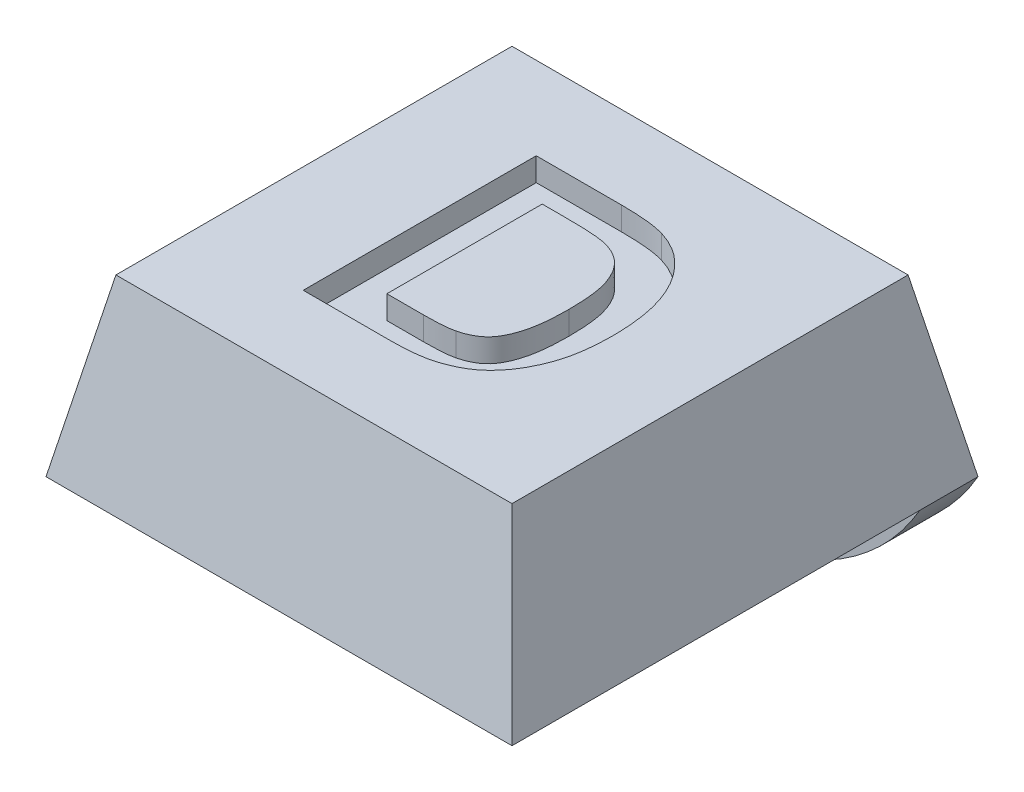
from build123d import *

# Parameters (mm, degrees)
SKETCH1_W               = 8
SKETCH1_H               = 8
BOSS_EXTRUDE1_DEPTH     = 3
CUT_EXTRUDE1_DEPTH      = 12.704699911
CUT_EXTRUDE1_DEPTH_BACK = 12.704699911
CUT_EXTRUDE2_DEPTH      = 11
SKETCH4_R               = 1.8
CUT_EXTRUDE3_DEPTH      = 0.8
SKETCH5_W               = 8
SKETCH5_H               = 1
BOSS_EXTRUDE2_DEPTH     = 2
FILLET1_R               = 4
CUT_EXTRUDE4_DEPTH      = 0.4


with BuildPart() as part:
    # Sketch1 → Boss-Extrude1 (new body)
    with BuildSketch(Plane(origin=(0, 0, 0), x_dir=(1, 0, 0), z_dir=(0, 1, 0))):
        with Locations((4, 4)):
            Rectangle(SKETCH1_W, SKETCH1_H)
    extrude(amount=BOSS_EXTRUDE1_DEPTH)

    # Sketch2 → Cut-Extrude1 (cut, two sides: drawn at the far end of the back side and taken through both)
    with BuildSketch(Plane.XY.offset(-CUT_EXTRUDE1_DEPTH_BACK)):
        Polygon((0, 0), (0.6, 3), (0, 3), align=None)
        Polygon((8, 0), (7.4, 3), (8, 3), align=None)
    extrude(amount=CUT_EXTRUDE1_DEPTH + CUT_EXTRUDE1_DEPTH_BACK, mode=Mode.SUBTRACT)

    # Sketch3 → Cut-Extrude2 (cut)
    with BuildSketch(Plane(origin=(0, 0, 0), x_dir=(0, 0, -1), z_dir=(1, 0, 0))):
        Polygon((0, 0), (0.6, 3), (0, 3), align=None)
        Polygon((8, 3), (7.4, 3), (8, 0), align=None)
    extrude(amount=CUT_EXTRUDE2_DEPTH, mode=Mode.SUBTRACT)

    # Sketch4 → Cut-Extrude3 (cut)
    with BuildSketch(Plane.XZ):
        with Locations(Location((4, -3.75, 0), (0, 0, 270))):
            Circle(SKETCH4_R)
    extrude(amount=-CUT_EXTRUDE3_DEPTH, mode=Mode.SUBTRACT)

    # Sketch5 → Boss-Extrude2 (add)
    with BuildSketch(Plane.XZ):
        with Locations((4, -7.5)):
            Rectangle(SKETCH5_W, SKETCH5_H)
    extrude(amount=BOSS_EXTRUDE2_DEPTH)

    # Fillet1
    # the kernel refuses this fillet: 4 mm, written as the material it takes off along each edge
    with BuildSketch(Plane(origin=(8, -2, -16.660254038), x_dir=(0, 1, 0), z_dir=(0, 0, 1)), Plane(origin=(0, -2, 1.660254038), x_dir=(0, 1, 0), z_dir=(0, 0, -1))) as fillet1_piece_1:
        with BuildLine():
            CenterArc((4, 3.464101615), FILLET1_R, 180, 60)
            Line((0, 3.464101615), (-0.08, 3.464101615))
            Line((-0.08, 3.464101615), (-0.08, 0))
            Line((-0.08, 0), (0, -0.08))
            ThreePointArc((0, -0.08), (1, -0.08), (1.96, -0.069282032))
            Line((1.96, -0.069282032), (2, 0))
        make_face()
    extrude(amount=18.320508076, mode=Mode.SUBTRACT)

    # Sketch6 → Cut-Extrude4 (cut)
    with BuildSketch(Plane(origin=(0, 3, 0), x_dir=(1, 0, 0), z_dir=(0, 1, 0))):
        with BuildLine():
            Line((2.436272881, 5.979723732), (3.903420317, 5.979723732))
            add(Edge.make_bspline(
                [(3.903420317, 5.979723732), (3.943490496, 5.979744505), (4.021516441, 5.979784954), (4.134752515, 5.975087302), (4.240642802, 5.970362082), (4.338883372, 5.960903224), (4.429815049, 5.950988663), (4.51360101, 5.938436084), (4.589711972, 5.922348579), (4.637707501, 5.909661658), (4.660631856, 5.903601937)],
                knots=[0, 0, 0, 0, 1.259756885, 2.453039283, 3.563158368, 4.591894114, 5.55549294, 6.43918076, 7.254497783, 8, 8, 8, 8], degree=3))
            add(Edge.make_bspline(
                [(4.660631856, 5.903601937), (4.689300162, 5.894258489), (4.74612039, 5.87573989), (4.829420592, 5.843292221), (4.908343197, 5.803050568), (4.985816138, 5.760749105), (5.058380803, 5.710732544), (5.129877456, 5.658697008), (5.195666079, 5.598419283), (5.281939397, 5.514177193), (5.380383811, 5.396825298), (5.483519335, 5.241163905), (5.570813292, 5.070304112), (5.630456537, 4.917219685), (5.670729972, 4.787084992), (5.697056277, 4.682749965), (5.719418871, 4.572846322), (5.737778631, 4.457346355), (5.752043635, 4.336250048), (5.762664083, 4.209589679), (5.767837312, 4.07725583), (5.769008616, 3.987205692), (5.769606215, 3.941262194)],
                knots=[0, 0, 0, 0, 0.745524535, 1.477620414, 2.207090574, 2.934465325, 3.657932502, 4.384347339, 5.118673636, 5.861150177, 7.365375624, 8.894729774, 10.468936425, 12.099947606, 12.950091786, 13.83580991, 14.759228729, 15.722225242, 16.726454549, 17.773376212, 18.863978586, 20, 20, 20, 20], degree=3))
            add(Edge.make_bspline(
                [(5.769606215, 3.941262194), (5.768515323, 3.861857727), (5.766405561, 3.708291084), (5.741963835, 3.486695058), (5.70674022, 3.280872561), (5.667035899, 3.152471539), (5.647811343, 3.090300655)],
                knots=[0, 0, 0, 0, 1.103207939, 2.133582005, 3.096293362, 4, 4, 4, 4], degree=3))
            add(Edge.make_bspline(
                [(5.647811343, 3.090300655), (5.635116766, 3.054625647), (5.610144552, 2.98444734), (5.566445051, 2.883214788), (5.519227431, 2.786877042), (5.468100041, 2.695510004), (5.412804571, 2.609524646), (5.353134197, 2.529178156), (5.290013855, 2.453412746), (5.244286819, 2.406778778), (5.221529292, 2.383569886)],
                knots=[0, 0, 0, 0, 1.090884612, 2.145940218, 3.175104604, 4.181306866, 5.161203701, 6.118658341, 7.063689906, 8, 8, 8, 8], degree=3))
            add(Edge.make_bspline(
                [(5.221529292, 2.383569886), (5.184702113, 2.350450915), (5.108759222, 2.282154876), (4.974934842, 2.197635799), (4.823675662, 2.122952418), (4.714264019, 2.084588805), (4.657426727, 2.06465963)],
                knots=[0, 0, 0, 0, 0.908140292, 1.872714733, 2.8949153, 4, 4, 4, 4], degree=3))
            add(Edge.make_bspline(
                [(4.657426727, 2.06465963), (4.634546833, 2.057632533), (4.587060796, 2.043048157), (4.511767003, 2.027471741), (4.431388989, 2.011061834), (4.344999886, 2.001176252), (4.253496453, 1.990751469), (4.156149493, 1.984898536), (4.053296456, 1.980743294), (3.98275208, 1.980068625), (3.946689548, 1.979723732)],
                knots=[0, 0, 0, 0, 0.799129865, 1.658552685, 2.566799617, 3.538529252, 4.561352959, 5.643373779, 6.795284424, 8, 8, 8, 8], degree=3))
            Line((3.946689548, 1.979723732), (2.436272881, 1.979723732))
            Line((2.436272881, 1.979723732), (2.436272881, 5.979723732))
        make_face()
        with BuildLine():
            Line((3.205503651, 5.313057065), (3.205503651, 2.646390399))
            Line((3.205503651, 2.646390399), (3.838516471, 2.646390399))
            add(Edge.make_bspline(
                [(3.838516471, 2.646390399), (3.86709534, 2.646617049), (3.922120581, 2.647053436), (4.001743514, 2.648335709), (4.07491632, 2.651807064), (4.142022322, 2.655402822), (4.202886818, 2.661343643), (4.257774639, 2.667186667), (4.306380252, 2.675360935), (4.336400272, 2.681813595), (4.350535702, 2.684851937)],
                knots=[0, 0, 0, 0, 1.333384787, 2.567275092, 3.714769766, 4.750907381, 5.701951617, 6.567520054, 7.325492842, 8, 8, 8, 8], degree=3))
            add(Edge.make_bspline(
                [(4.350535702, 2.684851937), (4.38364248, 2.693686468), (4.44812575, 2.710893803), (4.538666782, 2.749253907), (4.62059475, 2.795531175), (4.695281698, 2.8511776), (4.762590099, 2.92150181), (4.820046047, 3.011440962), (4.873220012, 3.118706088), (4.909633556, 3.221385639), (4.935771128, 3.313096613), (4.95346412, 3.390071897), (4.967446413, 3.47335137), (4.979473009, 3.562606359), (4.989190784, 3.657722085), (4.995237644, 3.759042029), (4.999364663, 3.866442163), (5.000032135, 3.940189623), (5.000375445, 3.978121168)],
                knots=[0, 0, 0, 0, 1.038686998, 2.023088296, 2.974059649, 3.888265163, 4.839857954, 5.909819677, 7.113156087, 8.466843969, 9.20827164, 10.006482943, 10.861893492, 11.769681931, 12.739021491, 13.762258324, 14.849031541, 16, 16, 16, 16], degree=3))
            add(Edge.make_bspline(
                [(5.000375445, 3.978121168), (5.000034775, 4.01605283), (4.999374834, 4.089533605), (4.995254144, 4.196132914), (4.989241251, 4.29585735), (4.979454269, 4.38883019), (4.967614104, 4.475179926), (4.953468032, 4.554979633), (4.935881696, 4.627705609), (4.909721893, 4.71410541), (4.870064977, 4.811221472), (4.816099655, 4.917402921), (4.749828382, 5.00790436), (4.676605078, 5.08652444), (4.592177372, 5.151224792), (4.498716105, 5.205415106), (4.394186359, 5.247475499), (4.319831067, 5.2653904), (4.281625445, 5.274595527)],
                knots=[0, 0, 0, 0, 1.117996097, 2.165769068, 3.143980016, 4.062055362, 4.920439205, 5.712587309, 6.449616741, 7.124491204, 8.371470382, 9.537068822, 10.625202851, 11.666538334, 12.693249444, 13.747832046, 14.842779399, 16, 16, 16, 16], degree=3))
            add(Edge.make_bspline(
                [(4.281625445, 5.274595527), (4.265088191, 5.27766838), (4.228679487, 5.284433627), (4.168262747, 5.292335475), (4.097380449, 5.298199321), (4.015671249, 5.304185793), (3.923465993, 5.307602683), (3.820378875, 5.311168762), (3.706841263, 5.312386928), (3.627511913, 5.312827267), (3.586112625, 5.313057065)],
                knots=[0, 0, 0, 0, 0.578738571, 1.274160813, 2.095454135, 3.025967819, 4.093109015, 5.270126069, 6.575371698, 8, 8, 8, 8], degree=3))
            Line((3.586112625, 5.313057065), (3.205503651, 5.313057065))
        make_face(mode=Mode.SUBTRACT)
    extrude(amount=-CUT_EXTRUDE4_DEPTH, mode=Mode.SUBTRACT)


solid = part.part
